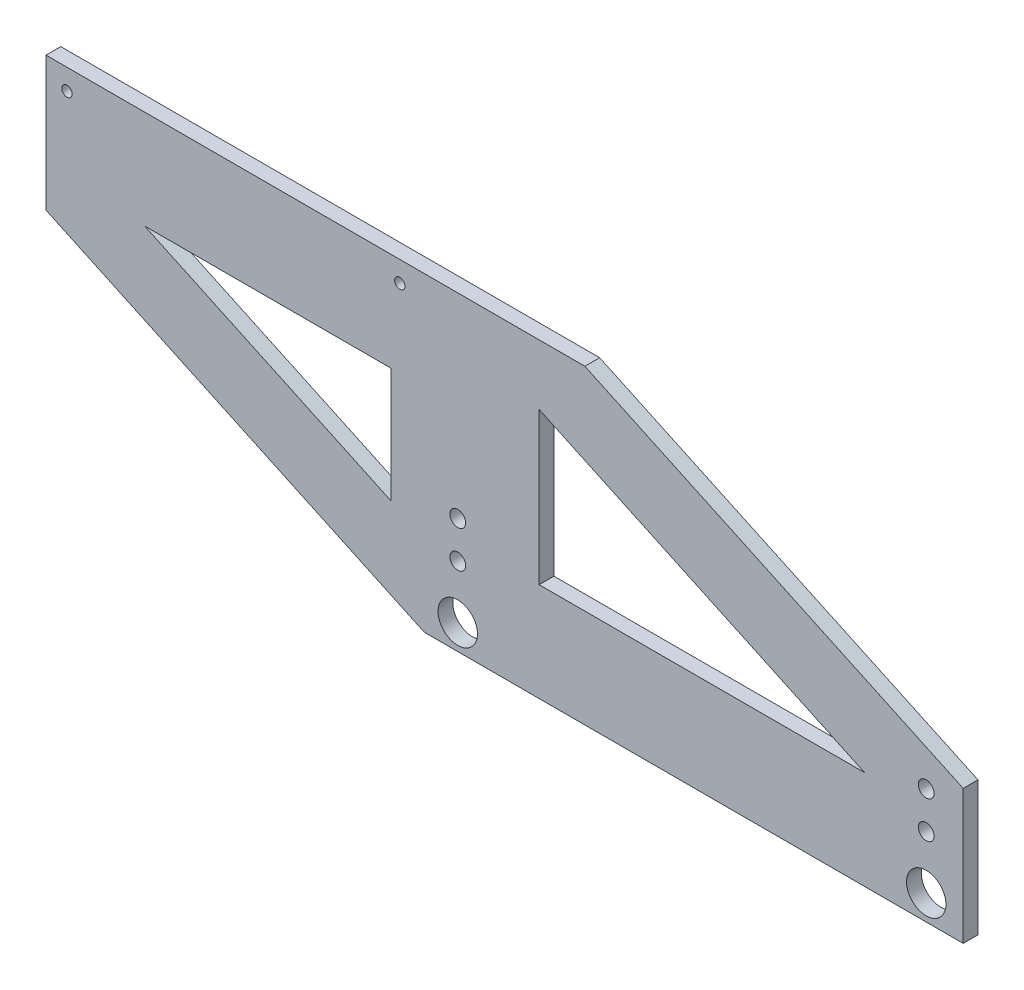
from build123d import *

# Parameters (mm, degrees)
SKETCH1_R      = 1.05
SKETCH1_R_2    = 4
SKETCH1_R_3    = 1.6
EXTRUDE1_DEPTH = 3


with BuildPart() as part:
    # Sketch1 → Extrude1 (new body)
    with BuildSketch(Plane.XY):
        Polygon((-83.5, 74.115427319), (25.779226165, 74.115427319), (102.5, 38.33994294), (102.5, 11.115427319), (-6.779226165, 11.115427319), (-83.5, 46.890911697), align=None)
        with Locations((-79.25, 69.915427319)):
            Circle(SKETCH1_R, mode=Mode.SUBTRACT)
        with Locations((-11.75, 69.915427319)):
            Circle(SKETCH1_R, mode=Mode.SUBTRACT)
        with Locations((0, 16.201854058)):
            Circle(SKETCH1_R_2, mode=Mode.SUBTRACT)
        with Locations((95, 16.201854058)):
            Circle(SKETCH1_R_2, mode=Mode.SUBTRACT)
        with Locations((95, 27)):
            Circle(SKETCH1_R_3, mode=Mode.SUBTRACT)
        with Locations((95, 34.5)):
            Circle(SKETCH1_R_3, mode=Mode.SUBTRACT)
        with Locations((0, 34.5)):
            Circle(SKETCH1_R_3, mode=Mode.SUBTRACT)
        with Locations((0, 27)):
            Circle(SKETCH1_R_3, mode=Mode.SUBTRACT)
        Polygon((-63.5, 54.115427319), (-13.5, 54.115427319), (-13.5, 30.800044411), align=None, mode=Mode.SUBTRACT)
        Polygon((16.5, 61.891732757), (16.5, 31.115427319), (82.5, 31.115427319), align=None, mode=Mode.SUBTRACT)
    extrude(amount=EXTRUDE1_DEPTH)


solid = part.part
